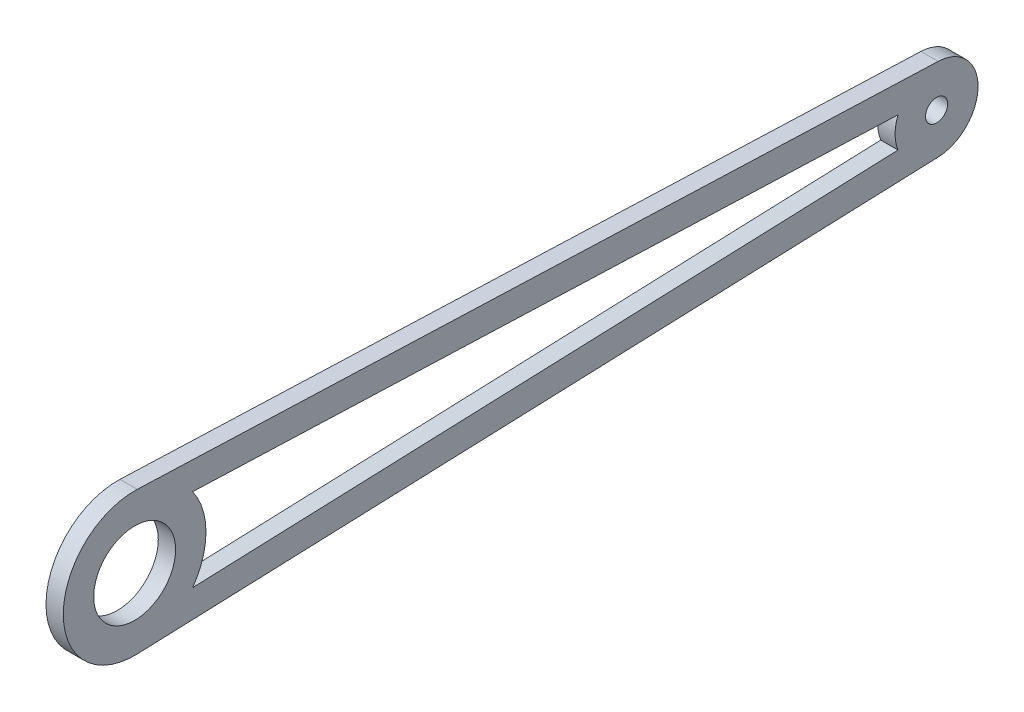
from build123d import *

# Parameters (mm, degrees)
SKETCH1_R           = 1.016
SKETCH1_R_2         = 3.7592
BOSS_EXTRUDE1_DEPTH = 1.5875


with BuildPart() as part:
    # Sketch1 → Boss-Extrude1 (new body)
    with BuildSketch(Plane(origin=(0, 0, 0), x_dir=(0, 0, -1), z_dir=(1, 0, 0))):
        with BuildLine():
            Line((73.801889655, 3.807357), (0.244050207, 6.54865404))
            ThreePointArc((0.244050207, 6.54865404), (-6.5532, -7.1e-08), (0.244050348, -6.548654035))
            Line((0.244050348, -6.548654035), (73.801889655, -3.807357))
            ThreePointArc((73.801889655, -3.807357), (77.47, 0), (73.801889655, 3.807357))
        make_face()
        with BuildLine():
            Line((5.32646714, 3.817483208), (70.117685948, 1.40289385))
            ThreePointArc((70.117685948, 1.40289385), (69.85, 0), (70.117685948, -1.40289385))
            Line((70.117685948, -1.40289385), (5.32646714, -3.817483208))
            ThreePointArc((5.32646714, -3.817483208), (6.5532, 0), (5.32646714, 3.817483208))
        make_face(mode=Mode.SUBTRACT)
        with Locations((73.66, 0)):
            Circle(SKETCH1_R, mode=Mode.SUBTRACT)
        Circle(SKETCH1_R_2, mode=Mode.SUBTRACT)
    extrude(amount=BOSS_EXTRUDE1_DEPTH)


solid = part.part
